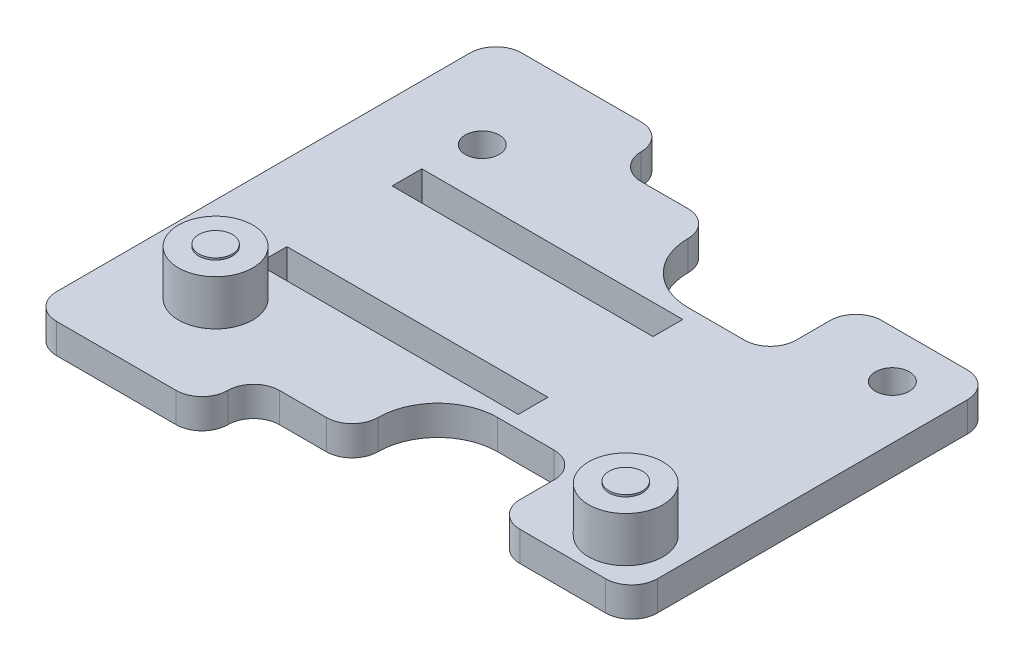
from build123d import *

# Parameters (mm, degrees)
EXTRUDE_1_DEPTH     = 4.6
SKETCH_1_R          = 2.625
SKETCH_1_W          = 40.4
SKETCH_1_H          = 4.6
CUT_EXTRUDE_1_DEPTH = 4.6
SKETCH_5_R          = 5.75
EXTRUDE_2_DEPTH     = 7
SKETCH_6_R          = 2.6
EXTRUDE_3_DEPTH     = 0.3
FILLET_2_R          = 4
FILLET_3_R          = 9.2625


with BuildPart() as part:
    # 草图3 → 凸台-拉伸1 (new body)
    with BuildSketch(Plane(origin=(0, 0, 0), x_dir=(1, 0, 0), z_dir=(0, 1, 0))):
        Polygon((-18.5, -28), (40, -28), (40, 28), (-18.5, 28), (-18.5, 36), (-45, 36), (-45, 28), (-45, -28), (-45, -36), (-18.5, -36), align=None)
    extrude(amount=EXTRUDE_1_DEPTH)

    # 草图1 → 切除-拉伸1 (cut)
    with BuildSketch(Plane(origin=(0, 0, 0), x_dir=(1, 0, 0), z_dir=(0, 1, 0))):
        with Locations(Location((-31.75, 20.6375, 0), (0, 0, 90))):
            Circle(SKETCH_1_R)
        with Locations(Location((31.75, 20.6375, 0), (0, 0, 90))):
            Circle(SKETCH_1_R)
        with Locations(Location((31.75, -20.6375, 0), (0, 0, 90))):
            Circle(SKETCH_1_R)
        with Locations(Location((-31.75, -20.6375, 0), (0, 0, 90))):
            Circle(SKETCH_1_R)
        with Locations((-13, -10.4375)):
            Rectangle(SKETCH_1_W, SKETCH_1_H)
        with Locations((-13, 10.4375)):
            Rectangle(SKETCH_1_W, SKETCH_1_H)
        Polygon((-3.25, -26.5375), (-3.25, -14.7375), (18.75, -14.7375), (18.75, -26.5375), (18.75, -29.869530405), (-3.25, -29.869530405), align=None)
        Polygon((-3.25, 14.7375), (18.75, 14.7375), (18.75, 26.5375), (18.75, 29.869530405), (-3.25, 29.869530405), (-3.25, 26.5375), align=None)
    extrude(amount=CUT_EXTRUDE_1_DEPTH, mode=Mode.SUBTRACT)

    # 草图5 → 凸台-拉伸2 (add)
    with BuildSketch(Plane(origin=(0, 4.6, 0), x_dir=(1, 0, 0), z_dir=(0, 1, 0))):
        with Locations(Location((31.75, -20.6375, 0), (0, 0, 90))):
            Circle(SKETCH_5_R)
    extrude_2 = extrude(amount=EXTRUDE_2_DEPTH)

    # 草图6 → 凸台-拉伸3 (add)
    with BuildSketch(Plane(origin=(0, 11.6, 0), x_dir=(1, 0, 0), z_dir=(0, 1, 0))):
        with Locations(Location((31.75, -20.6375, 0), (0, 0, 270))):
            Circle(SKETCH_6_R)
    extrude_3 = extrude(amount=EXTRUDE_3_DEPTH)

    # 圆角2
    fillet_2_edges = [part.edges().sort_by_distance(p)[0] for p in [
        (-3.25, 2.3, -28),
        (18.75, 2.3, -28),
        (40, 2.3, -28),
        (40, 2.3, 28),
        (18.75, 2.3, 28),
        (-3.25, 2.3, 28),
        (18.75, 2.3, -14.7375),
        (18.75, 2.3, 14.7375),
        (-18.5, 2.3, 28),
        (-18.5, 2.3, 36),
        (-45, 2.3, 36),
        (-45, 2.3, -36),
        (-18.5, 2.3, -36),
        (-18.5, 2.3, -28),
    ]]
    fillet(fillet_2_edges, radius=FILLET_2_R - 0.0001)  # a hair under: the kernel refuses the full size

    # 镜向1: 凸台-拉伸2, 凸台-拉伸3 across plane
    add(extrude_2.mirror(Plane(origin=(0, 0, 0), x_dir=(0, 0, 1), z_dir=(1, 0, 0))))
    add(extrude_3.mirror(Plane(origin=(0, 0, 0), x_dir=(0, 0, 1), z_dir=(1, 0, 0))))

    # 圆角3
    fillet_3_edges = [part.edges().sort_by_distance(p)[0] for p in [
        (-3.25, 2.3, -14.7375),
        (-3.25, 2.3, 14.7375),
    ]]
    fillet(fillet_3_edges, radius=FILLET_3_R)


solid = part.part
